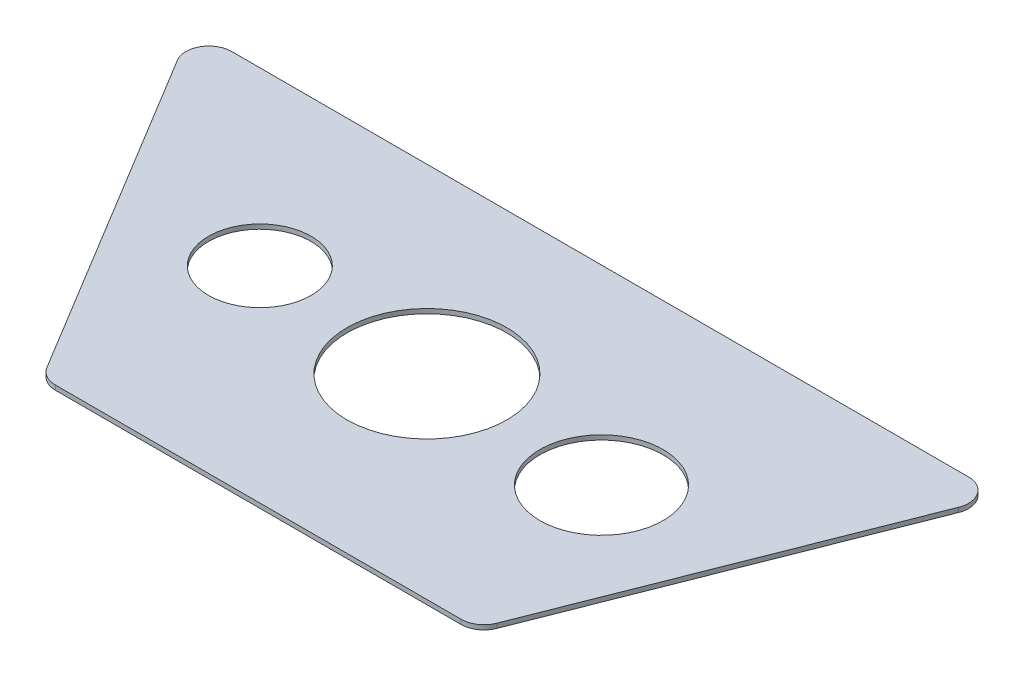
from build123d import *

# Parameters (mm, degrees)
BOSS_EXTRUDE1_DEPTH = 2
FILLET1_R           = 10
SKETCH3_R           = 22.450613329
SKETCH3_R_2         = 34.989698471
SKETCH3_R_3         = 26.958031069
CUT_EXTRUDE1_DEPTH  = 2


with BuildPart() as part:
    # Sketch2 → Boss-Extrude1 (new body)
    with BuildSketch(Plane(origin=(0, 0, 0), x_dir=(1, 0, 0), z_dir=(0, 1, 0))):
        Polygon((0, 0), (65, 165), (-290, 165), (-190, 0), align=None)
    extrude(amount=BOSS_EXTRUDE1_DEPTH)

    # Fillet1
    fillet1_edges = [part.edges().sort_by_distance(p)[0] for p in [
        (-190, 1, 0),
        (-290, 1, -165),
        (65, 1, -165),
        (0, 1, 0),
    ]]
    fillet(fillet1_edges, radius=FILLET1_R)

    # Sketch3 → Cut-Extrude1 (cut)
    with BuildSketch(Plane(origin=(0, 2, 0), x_dir=(1, 0, 0), z_dir=(0, 1, 0))):
        with Locations((-184.836537703, 89.923186665)):
            Circle(SKETCH3_R)
        with Locations((-107.345711052, 85.577906666)):
            Circle(SKETCH3_R_2)
        with Locations((-26.958031069, 81.594733334)):
            Circle(SKETCH3_R_3)
    extrude(amount=-CUT_EXTRUDE1_DEPTH, mode=Mode.SUBTRACT)


solid = part.part
